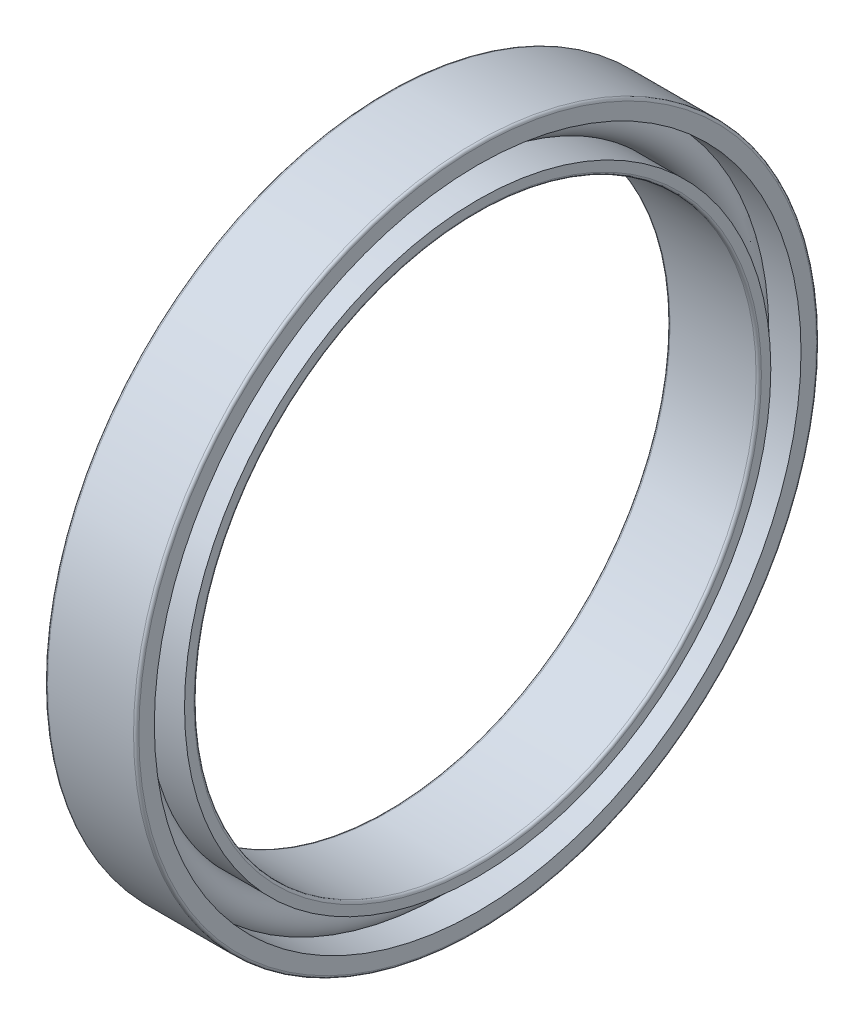
from build123d import *

# Parameters (mm, degrees)
CAGSPISKE_W     = 32.25
CAGSPISKE_H     = 21.5
CAGESPINE_ANGLE = 0.001
BALSIMSKE_R     = 64.5


with BuildPart() as part:
    # CagSpiSke → CageSpine (revolve)
    with BuildSketch(Plane.XY):
        with Locations((0, 1107.5)):
            Rectangle(CAGSPISKE_W, CAGSPISKE_H)
    revolve(axis=Axis((-20.6375, 0, 0), (1, 0, 0)), revolution_arc=CAGESPINE_ANGLE)

    # BalSimSke → BallsSimplified (revolve)
    with BuildSketch(Plane.XY):
        with Locations((0, 1107.5)):
            Circle(BALSIMSKE_R)
    revolve(axis=Axis((-10, 0, 0), (1, 0, 0)))

    # InnRacSke → InnerRace (revolve)
    with BuildSketch(Plane.XY):
        with BuildLine():
            Line((-48.041915293, 1064.5), (-162.5, 1064.5))
            Line((-162.5, 1064.5), (-162.5, 1009.5))
            ThreePointArc((-162.5, 1009.5), (-159.717514421, 1002.782485579), (-153, 1000))
            Line((-153, 1000), (153, 1000))
            ThreePointArc((153, 1000), (159.717514421, 1002.782485579), (162.5, 1009.5))
            Line((162.5, 1009.5), (162.5, 1043.025))
            Line((162.5, 1043.025), (0, 1043.025))
            ThreePointArc((0, 1043.025), (-26.311600341, 1048.638082664), (-48.041915293, 1064.5))
        make_face()
    revolve(axis=Axis((-20.6375, 0, 0), (1, 0, 0)))

    # OutRacSke → OuterRace (revolve)
    with BuildSketch(Plane.XY):
        with BuildLine():
            Line((0, 1171.975), (-162.5, 1171.975))
            Line((-162.5, 1171.975), (-162.5, 1205.5))
            ThreePointArc((-162.5, 1205.5), (-159.717514421, 1212.217514421), (-153, 1215))
            Line((-153, 1215), (153, 1215))
            ThreePointArc((153, 1215), (159.717514421, 1212.217514421), (162.5, 1205.5))
            Line((162.5, 1205.5), (162.5, 1150.5))
            Line((162.5, 1150.5), (48.041915293, 1150.5))
            ThreePointArc((48.041915293, 1150.5), (26.311600341, 1166.361917336), (0, 1171.975))
        make_face()
    revolve(axis=Axis((-20.6375, 0, 0), (1, 0, 0)))


solid = part.part
